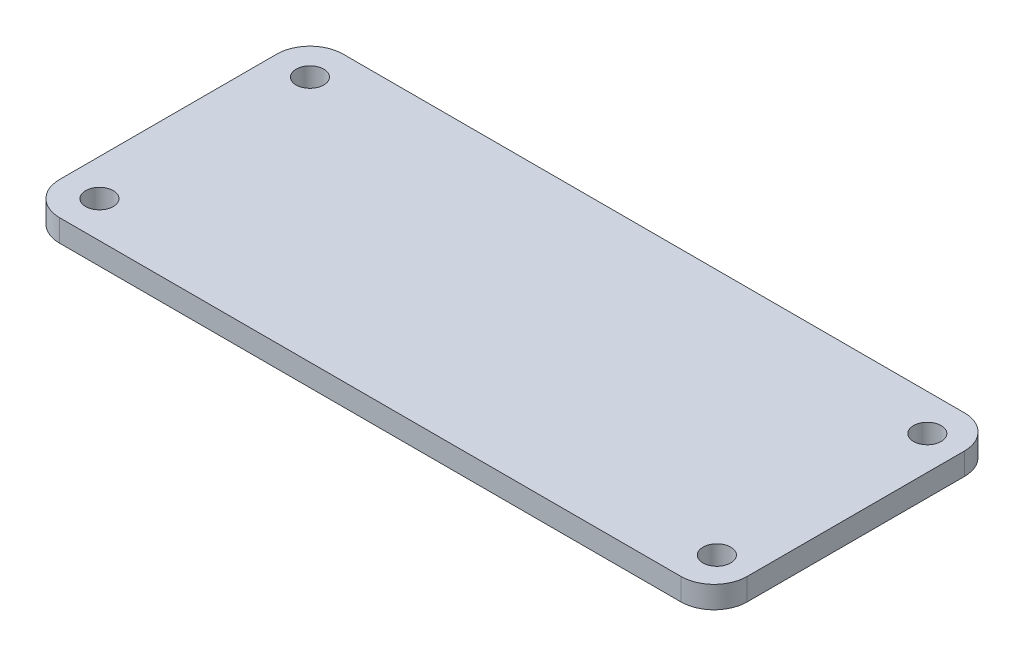
from build123d import *

# Parameters (mm, degrees)
SKETCH1_W           = 62.23
SKETCH1_H           = 25.654
BOSS_EXTRUDE1_DEPTH = 2
SKETCH2_R           = 1.25
CUT_EXTRUDE1_DEPTH  = 2
FILLET1_R           = 3


with BuildPart() as part:
    # Sketch1 → Boss-Extrude1 (new body)
    with BuildSketch(Plane(origin=(0, 0, 0), x_dir=(1, 0, 0), z_dir=(0, 1, 0))):
        Rectangle(SKETCH1_W, SKETCH1_H)
    extrude(amount=BOSS_EXTRUDE1_DEPTH)

    # Sketch2 → Cut-Extrude1 (cut)
    with BuildSketch(Plane(origin=(0, 2, 0), x_dir=(1, 0, 0), z_dir=(0, 1, 0))):
        with Locations((-27.813, 9.525)):
            Circle(SKETCH2_R)
        with Locations((28.067, 9.525)):
            Circle(SKETCH2_R)
        with Locations((28.067, -9.525)):
            Circle(SKETCH2_R)
        with Locations((-27.813, -9.525)):
            Circle(SKETCH2_R)
    extrude(amount=-CUT_EXTRUDE1_DEPTH, mode=Mode.SUBTRACT)

    # Fillet1
    fillet1_edges = [part.edges().sort_by_distance(p)[0] for p in [
        (31.115, 1, 12.827),
        (31.115, 1, -12.827),
        (-31.115, 1, -12.827),
        (-31.115, 1, 12.827),
    ]]
    fillet(fillet1_edges, radius=FILLET1_R)


solid = part.part
